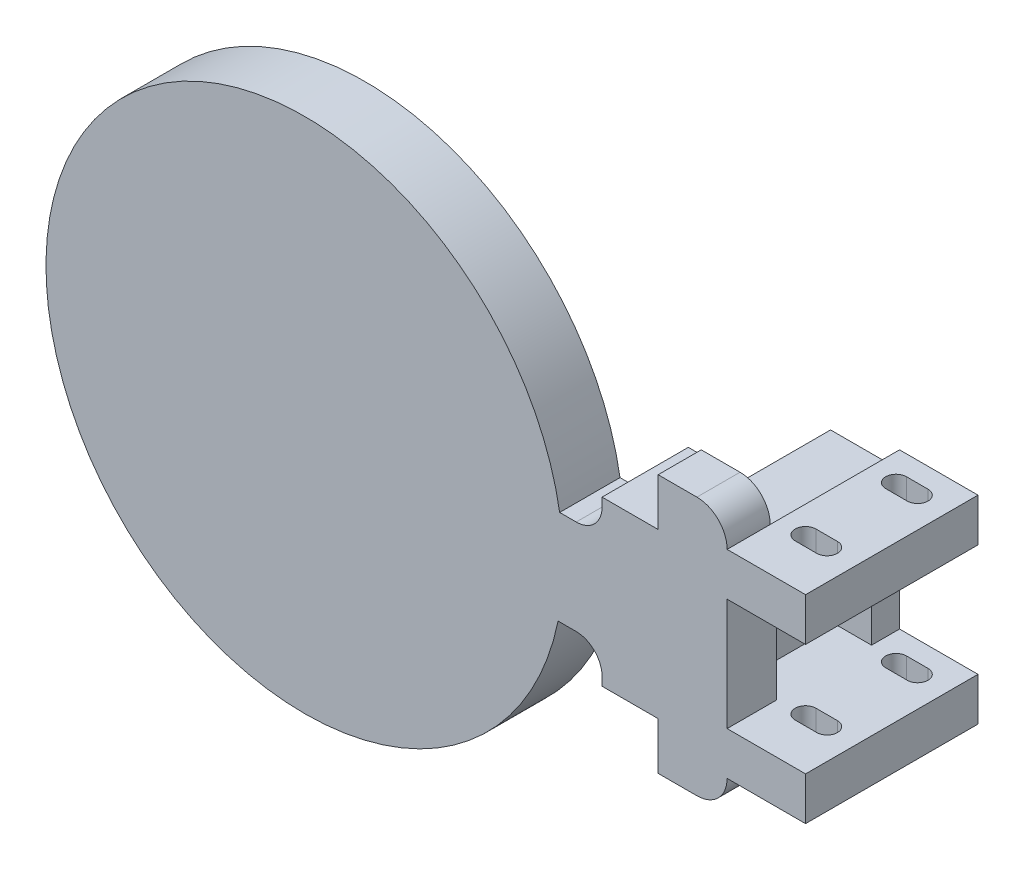
from build123d import *

# Parameters (mm, degrees)
SKETCH_1_W          = 10
SKETCH_1_H          = 19
EXTRUDE_1_DEPTH     = 6.5
EXTRUDE_2_DEPTH     = 7
FILLET_1_R          = 3
SKETCH_3_W          = 5
SKETCH_3_H          = 30
EXTRUDE_3_DEPTH     = 8
SKETCH_4_W          = 8
SKETCH_4_H          = 19
EXTRUDE_4_DEPTH     = 15
SKETCH_6_W          = 11
SKETCH_6_H          = 13
CUT_EXTRUDE_1_DEPTH = 4
SKETCH_8_W          = 9.1
SKETCH_8_H          = 20
EXTRUDE_5_DEPTH     = 3
SKETCH_8_2_W        = 9.1
SKETCH_8_2_H        = 20
EXTRUDE_6_DEPTH     = 2
FILLET_2_R          = 3.5
FILLET_3_R          = 3


with BuildPart() as part:
    # 草圖1 → 填料-伸長1 (new body)
    with BuildSketch(Plane(origin=(0, 0, 0), x_dir=(0, 0, -1), z_dir=(1, 0, 0))):
        with Locations((5, 9.5)):
            Rectangle(SKETCH_1_W, SKETCH_1_H)
    extrude(amount=-EXTRUDE_1_DEPTH)

    # 草圖2 → 填料-伸長2 (add)
    with BuildSketch(Plane.XY):
        with BuildLine():
            Line((-11.419601085, 15), (-6.5, 15))
            Line((-6.5, 15), (-6.5, 4))
            Line((-6.5, 4), (-11.606123087, 4))
            ThreePointArc((-11.606123087, 4), (-70.995688063, 10.508623254), (-11.419601085, 15))
        make_face()
    extrude(amount=-EXTRUDE_2_DEPTH)

    # 圓角1
    fillet_1_edges = [part.edges().sort_by_distance(p)[0] for p in [
        (-6.5, 9.5, -7),
    ]]
    fillet(fillet_1_edges, radius=FILLET_1_R - 0.0001)  # a hair under: the kernel refuses the full size

    # 草圖3 → 填料-伸長3 (add)
    with BuildSketch(Plane(origin=(0, 0, 0), x_dir=(0, 0, -1), z_dir=(1, 0, 0))):
        with Locations((2.5, 9.5)):
            Rectangle(SKETCH_3_W, SKETCH_3_H)
    extrude(amount=EXTRUDE_3_DEPTH)

    # 草圖4 → 填料-伸長4 (add)
    with BuildSketch(Plane(origin=(0, 0, -5), x_dir=(-1, 0, 0), z_dir=(0, 0, -1))):
        with Locations((-4, 9.5)):
            Rectangle(SKETCH_4_W, SKETCH_4_H)
    extrude(amount=EXTRUDE_4_DEPTH)

    # 草圖6 → 除料-伸長1 (cut)
    with BuildSketch(Plane(origin=(8, 0, 0), x_dir=(0, 0, -1), z_dir=(1, 0, 0))):
        with Locations((11.25, 9.5)):
            Rectangle(SKETCH_6_W, SKETCH_6_H)
    extrude(amount=-CUT_EXTRUDE_1_DEPTH, mode=Mode.SUBTRACT)

    # 草圖8 → 填料-伸長5 (add)
    with BuildSketch(Plane(origin=(0, 19, 0), x_dir=(1, 0, 0), z_dir=(0, 1, 0))):
        with Locations((12.55, 10)):
            Rectangle(SKETCH_8_W, SKETCH_8_H)
        with BuildLine():
            Line((13.6, 15.3), (11.1, 15.3))
            ThreePointArc((11.1, 15.3), (9.9, 16.5), (11.1, 17.7))
            Line((11.1, 17.7), (13.6, 17.7))
            ThreePointArc((13.6, 17.7), (14.8, 16.5), (13.6, 15.3))
        make_face(mode=Mode.SUBTRACT)
        with BuildLine():
            Line((13.6, 4.8), (11.1, 4.8))
            ThreePointArc((11.1, 4.8), (9.9, 6), (11.1, 7.2))
            Line((11.1, 7.2), (13.6, 7.2))
            ThreePointArc((13.6, 7.2), (14.8, 6), (13.6, 4.8))
        make_face(mode=Mode.SUBTRACT)
    extrude_5 = extrude(amount=-EXTRUDE_5_DEPTH)

    # 鏡射1: 填料-伸長5 across plane
    add(extrude_5.mirror(Plane.ZX.offset(9.5)))

    # 草圖8<2> → 填料-伸長6 (add)
    with BuildSketch(Plane(origin=(0, 19, 0), x_dir=(1, 0, 0), z_dir=(0, 1, 0))):
        with Locations((12.55, 10)):
            Rectangle(SKETCH_8_2_W, SKETCH_8_2_H)
        with BuildLine():
            Line((13.6, 15.3), (11.1, 15.3))
            ThreePointArc((11.1, 15.3), (9.9, 16.5), (11.1, 17.7))
            Line((11.1, 17.7), (13.6, 17.7))
            ThreePointArc((13.6, 17.7), (14.8, 16.5), (13.6, 15.3))
        make_face(mode=Mode.SUBTRACT)
        with BuildLine():
            Line((13.6, 4.8), (11.1, 4.8))
            ThreePointArc((11.1, 4.8), (9.9, 6), (11.1, 7.2))
            Line((11.1, 7.2), (13.6, 7.2))
            ThreePointArc((13.6, 7.2), (14.8, 6), (13.6, 4.8))
        make_face(mode=Mode.SUBTRACT)
    extrude_6 = extrude(amount=EXTRUDE_6_DEPTH)

    # 鏡射2: 填料-伸長6 across plane
    add(extrude_6.mirror(Plane.ZX.offset(9.5)))

    # 圓角2
    fillet_2_edges = [part.edges().sort_by_distance(p)[0] for p in [
        (8, 24.5, -2.5),
        (8, -5.5, -2.5),
    ]]
    fillet(fillet_2_edges, radius=FILLET_2_R - 0.0001)  # a hair under: the kernel refuses the full size

    # 圓角3
    fillet_3_edges = [part.edges().sort_by_distance(p)[0] for p in [
        (-6.5, 4, -4.99995),
        (-6.5, 15, -4.99995),
    ]]
    fillet(fillet_3_edges, radius=FILLET_3_R - 0.0001)  # a hair under: the kernel refuses the full size


solid = part.part
